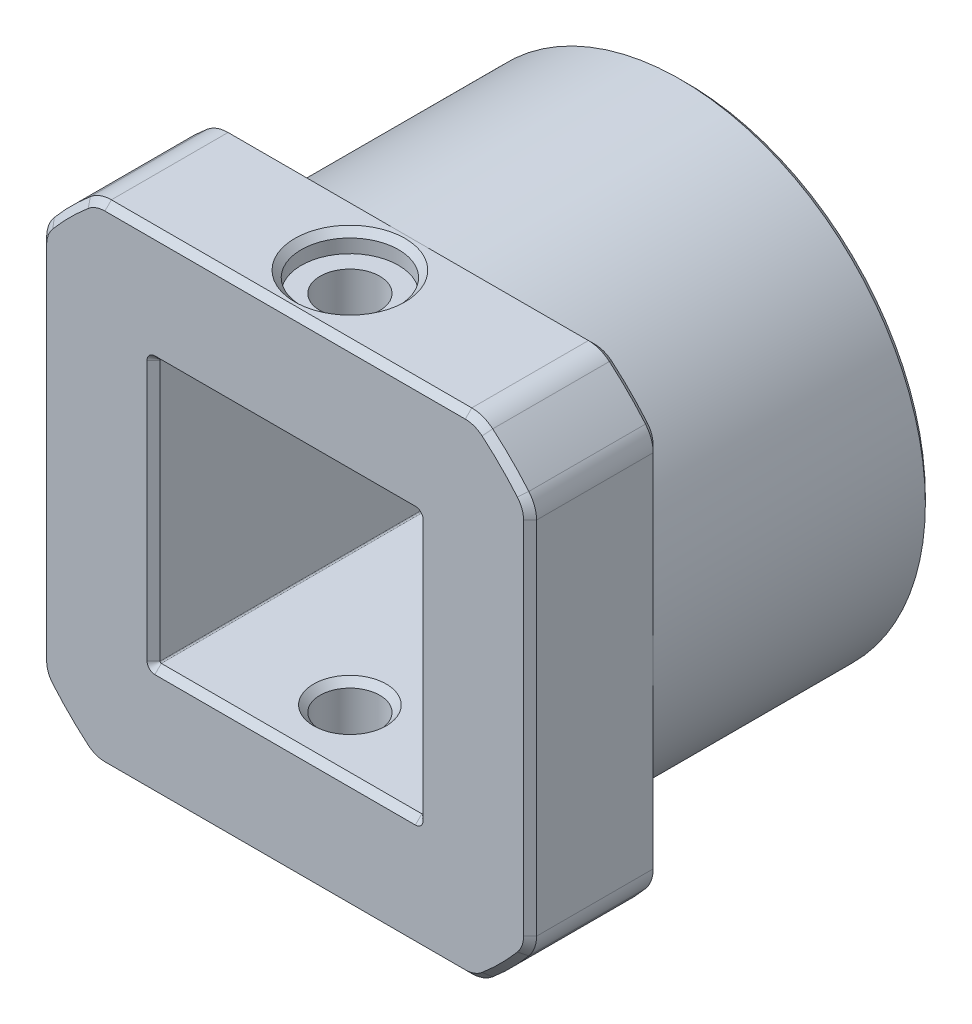
from build123d import *

# Parameters (mm, degrees)
SKIZZE1_R                       = 18.9
SKIZZE1_W                       = 20.3
SKIZZE1_H                       = 20.3
AUFSATZ_LINEAR_AUSTRAGEN1_DEPTH = 21
SKIZZE2_W                       = 20.3
SKIZZE2_H                       = 20.3
AUFSATZ_LINEAR_AUSTRAGEN2_DEPTH = 10
SKIZZE3_R                       = 2.3
SCHNITT_LINEAR_AUSTRAGEN1_DEPTH = 53.412307715
SKETCH1_R                       = 3.75
CUT_EXTRUDE1_DEPTH              = 1.55
CUT_EXTRUDE2_START              = -36.25
SKETCH1_2_R                     = 3.75
CUT_EXTRUDE2_DEPTH              = 1.55
VERRUNDUNG1_R                   = 0.1
VERRUNDUNG2_R                   = 2.5
FASE1_SIZE                      = 0.5
FASE4_SIZE                      = 0.5


with BuildPart() as part:
    # Skizze1 → Aufsatz-Linear austragen1 (new body)
    with BuildSketch(Plane.XY):
        with Locations(Location((0, 0, 0), (0, 0, 180))):
            Circle(SKIZZE1_R)
        Rectangle(SKIZZE1_W, SKIZZE1_H, mode=Mode.SUBTRACT)
    extrude(amount=AUFSATZ_LINEAR_AUSTRAGEN1_DEPTH)

    # Skizze2 → Aufsatz-Linear austragen2 (add)
    with BuildSketch(Plane.XY.offset(21)):
        with BuildLine():
            Line((-14.791551643, 18.9), (14.791551643, 18.9))
            ThreePointArc((14.791551643, 18.9), (16.970562748, 16.970562748), (18.9, 14.791551643))
            Line((18.9, 14.791551643), (18.9, -14.791551643))
            ThreePointArc((18.9, -14.791551643), (16.970562748, -16.970562748), (14.791551643, -18.9))
            Line((14.791551643, -18.9), (-14.791551643, -18.9))
            ThreePointArc((-14.791551643, -18.9), (-16.970562748, -16.970562748), (-18.9, -14.791551643))
            Line((-18.9, -14.791551643), (-18.9, 14.791551643))
            ThreePointArc((-18.9, 14.791551643), (-16.970562748, 16.970562748), (-14.791551643, 18.9))
        make_face()
        Rectangle(SKIZZE2_W, SKIZZE2_H, mode=Mode.SUBTRACT)
    extrude(amount=AUFSATZ_LINEAR_AUSTRAGEN2_DEPTH)

    # Skizze3 → Schnitt-Linear austragen1 (cut, through all)
    with BuildSketch(Plane(origin=(0, 18.9, 0), x_dir=(1, 0, 0), z_dir=(0, 1, 0))):
        with Locations(Location((0, -26, 0), (0, 0, 270))):
            Circle(SKIZZE3_R)
    extrude(amount=-SCHNITT_LINEAR_AUSTRAGEN1_DEPTH, mode=Mode.SUBTRACT)

    # Sketch1 → Cut-Extrude1 (cut)
    with BuildSketch(Plane(origin=(0, 18.9, 0), x_dir=(1, 0, 0), z_dir=(0, 1, 0))):
        with Locations(Location((0, -26, 0), (0, 0, 270))):
            Circle(SKETCH1_R)
    extrude(amount=-CUT_EXTRUDE1_DEPTH, mode=Mode.SUBTRACT)

    # Sketch1<2> → Cut-Extrude2 (cut)
    with BuildSketch(Plane(origin=(0, 18.9, 0), x_dir=(1, 0, 0), z_dir=(0, 1, 0)).offset(CUT_EXTRUDE2_START)):
        with Locations(Location((0, -26, 0), (0, 0, 270))):
            Circle(SKETCH1_2_R)
    extrude(amount=-CUT_EXTRUDE2_DEPTH, mode=Mode.SUBTRACT)

    # Verrundung1
    verrundung1_edges = [part.edges().sort_by_distance(p)[0] for p in [
        (10.15, -10.15, 15.5),
        (10.15, 10.15, 15.5),
        (-10.15, 10.15, 15.5),
        (-10.15, -10.15, 15.5),
    ]]
    fillet(verrundung1_edges, radius=VERRUNDUNG1_R)

    # Verrundung2
    verrundung2_edges = [part.edges().sort_by_distance(p)[0] for p in [
        (-14.791551643, 18.9, 26),
        (-18.9, 14.791551643, 26),
        (-18.9, -14.791551643, 26),
        (-14.791551643, -18.9, 26),
        (14.791551643, -18.9, 26),
        (18.9, -14.791551643, 26),
        (18.9, 14.791551643, 26),
        (14.791551643, 18.9, 26),
    ]]
    fillet(verrundung2_edges, radius=VERRUNDUNG2_R)

    # Fase1
    fase1_edges = [part.edges().sort_by_distance(p)[0] for p in [
        (-16.970562748, -16.970562748, 31),
        (-18.9, 0, 31),
        (-16.970562748, 16.970562748, 31),
        (0, -18.9, 31),
        (16.970562748, -16.970562748, 31),
        (18.9, 0, 31),
        (16.970562748, 16.970562748, 31),
        (0, 18.9, 31),
        (-14.76385305, 18.747066452, 31),
        (-18.747066452, 14.76385305, 31),
        (14.76385305, 18.747066452, 31),
        (18.747066452, 14.76385305, 31),
        (18.747066452, -14.76385305, 31),
        (14.76385305, -18.747066452, 31),
        (-14.76385305, -18.747066452, 31),
        (-18.747066452, -14.76385305, 31),
        (18.9, 0, 0),
        (0, -10.15, 23.7),
        (0, 10.15, 23.7),
        (0, 18.9, 22.25),
        (0, -18.9, 22.25),
        (0, -10.15, 0),
        (0, -10.15, 31),
        (10.15, 0, 0),
        (10.15, 0, 31),
        (-10.15, 0, 0),
        (-10.15, 0, 31),
        (0, 10.15, 0),
        (0, 10.15, 31),
        (10.120710678, -10.120710678, 0),
        (10.120710678, -10.120710678, 31),
        (-10.120710678, -10.120710678, 0),
        (-10.120710678, -10.120710678, 31),
        (-10.120710678, 10.120710678, 0),
        (-10.120710678, 10.120710678, 31),
        (10.120710678, 10.120710678, 0),
        (10.120710678, 10.120710678, 31),
    ]]
    chamfer(fase1_edges, length=FASE1_SIZE)

    # Fase4
    # the kernel refuses this chamfer: 0.5 mm, written as the material it takes off along each edge
    with BuildSketch(Plane(origin=(0, 0, 21), x_dir=(-0.6466454604660656, -0.762790697674421, 0), z_dir=(0.762790697674421, -0.6466454604660656, 0))) as fase4_piece_1:
        Polygon((24, -FASE4_SIZE), (24 - FASE4_SIZE, 0), (24, 0), align=None)
    revolve(axis=Axis((0, 0, 21), (0, 0, -1)), revolution_arc=9.421682318, mode=Mode.SUBTRACT)
    with BuildSketch(Plane(origin=(0, -18.9, 21), x_dir=(0, -0.027495876610589005, 0.9996219169112968), z_dir=(-1, 0, 0))) as fase4_piece_2_section:
        Polygon((FASE4_SIZE * 0.999621916911, FASE4_SIZE * 0.0274958766106), (-FASE4_SIZE * 0.0274958766106, FASE4_SIZE * 0.999621916911), (0, 0), align=None)
    fase4_piece_2 = extrude(amount=13.9028774, mode=Mode.PRIVATE)
    fase4_piece_2 = fase4_piece_2 - Plane(origin=(0, 0, 21.173530337), x_dir=(-1, 0, 0), z_dir=(0, 0, -1)) * Cylinder(18.9, 30, mode=Mode.PRIVATE)
    add(fase4_piece_2, mode=Mode.SUBTRACT)
    with BuildSketch(Plane(origin=(-13.9028774, -16.4, 21), x_dir=(0, -1, 0), z_dir=(1, 0, 0))) as fase4_piece_3:
        Polygon((2.5, -FASE4_SIZE), (2.5 - FASE4_SIZE, 0), (2.5, 0), align=None)
    revolve(axis=Axis((-13.9028774, -16.4, 21), (0, 0, -1)), revolution_arc=40.289158841, mode=Mode.SUBTRACT)
    with BuildSketch(Plane(origin=(-16.4, -13.9028774, 21), x_dir=(-0.7627906976744183, -0.6466454604660687, 0), z_dir=(0.6466454604660687, -0.7627906976744183, 0))) as fase4_piece_4:
        Polygon((2.5, -FASE4_SIZE), (2.5 - FASE4_SIZE, 0), (2.5, 0), align=None)
    revolve(axis=Axis((-16.4, -13.9028774, 21), (0, 0, -1)), revolution_arc=40.289158841, mode=Mode.SUBTRACT)
    with BuildSketch(Plane(origin=(-18.9, 0, 21), x_dir=(-0.027495876610589005, 0, 0.9996219169112968), z_dir=(0, 1, 0))) as fase4_piece_5_section:
        Polygon((FASE4_SIZE * 0.999621916911, FASE4_SIZE * 0.0274958766106), (-FASE4_SIZE * 0.0274958766106, FASE4_SIZE * 0.999621916911), (0, 0), align=None)
    fase4_piece_5 = extrude(amount=13.9028774, mode=Mode.PRIVATE)
    fase4_piece_5 = fase4_piece_5 - Plane(origin=(0, 0, 21.173530342), x_dir=(-1, 0, 0), z_dir=(0, 0, -1)) * Cylinder(18.9, 30, mode=Mode.PRIVATE)
    add(fase4_piece_5, mode=Mode.SUBTRACT)
    with BuildSketch(Plane(origin=(0, 0, 21), x_dir=(0.7627906976744181, -0.646645460466069, 0), z_dir=(0.646645460466069, 0.7627906976744181, 0))) as fase4_piece_6:
        Polygon((24, -FASE4_SIZE), (24 - FASE4_SIZE, 0), (24, 0), align=None)
    revolve(axis=Axis((0, 0, 21), (0, 0, -1)), revolution_arc=9.421682318, mode=Mode.SUBTRACT)
    with BuildSketch(Plane(origin=(18.9, -8.6e-08, 21), x_dir=(0.027495876610589005, 0, 0.9996219169112968), z_dir=(0, -1, 0))) as fase4_piece_7_section:
        Polygon((FASE4_SIZE * 0.999621916911, FASE4_SIZE * 0.0274958766106), (-FASE4_SIZE * 0.0274958766106, FASE4_SIZE * 0.999621916911), (0, 0), align=None)
    fase4_piece_7 = extrude(amount=13.902877314, mode=Mode.PRIVATE)
    fase4_piece_7 = fase4_piece_7 - Plane(origin=(0, 0, 21.173530337), x_dir=(-1, 0, 0), z_dir=(0, 0, -1)) * Cylinder(18.9, 30, mode=Mode.PRIVATE)
    add(fase4_piece_7, mode=Mode.SUBTRACT)
    with BuildSketch(Plane(origin=(16.4, -13.9028774, 21), x_dir=(1, 0, 0), z_dir=(0, 1, 0))) as fase4_piece_8:
        Polygon((2.5, -FASE4_SIZE), (2.5 - FASE4_SIZE, 0), (2.5, 0), align=None)
    revolve(axis=Axis((16.4, -13.9028774, 21), (0, 0, -1)), revolution_arc=40.289158841, mode=Mode.SUBTRACT)
    with BuildSketch(Plane(origin=(13.9028774, -16.4, 21), x_dir=(0.64664546046607, -0.7627906976744174, 0), z_dir=(0.7627906976744174, 0.64664546046607, 0))) as fase4_piece_9:
        Polygon((2.5, -FASE4_SIZE), (2.5 - FASE4_SIZE, 0), (2.5, 0), align=None)
    revolve(axis=Axis((13.9028774, -16.4, 21), (0, 0, -1)), revolution_arc=40.289158841, mode=Mode.SUBTRACT)
    with BuildSketch(Plane(origin=(0, 0, 21), x_dir=(0.6466454604660691, 0.762790697674418, 0), z_dir=(-0.762790697674418, 0.6466454604660691, 0))) as fase4_piece_10:
        Polygon((24, -FASE4_SIZE), (24 - FASE4_SIZE, 0), (24, 0), align=None)
    revolve(axis=Axis((0, 0, 21), (0, 0, -1)), revolution_arc=9.421682318, mode=Mode.SUBTRACT)
    with BuildSketch(Plane(origin=(2.2e-08, 18.9, 21), x_dir=(0, 0.027495876610589005, 0.9996219169112968), z_dir=(1, 0, 0))) as fase4_piece_11_section:
        Polygon((FASE4_SIZE * 0.999621916911, FASE4_SIZE * 0.0274958766106), (-FASE4_SIZE * 0.0274958766106, FASE4_SIZE * 0.999621916911), (0, 0), align=None)
    fase4_piece_11 = extrude(amount=13.902877378, mode=Mode.PRIVATE)
    fase4_piece_11 = fase4_piece_11 - Plane(origin=(0, 0, 21.173530337), x_dir=(-1, 0, 0), z_dir=(0, 0, -1)) * Cylinder(18.9, 30, mode=Mode.PRIVATE)
    add(fase4_piece_11, mode=Mode.SUBTRACT)
    with BuildSketch(Plane(origin=(13.9028774, 16.4, 21), x_dir=(0, 1, 0), z_dir=(-1, 0, 0))) as fase4_piece_12:
        Polygon((2.5, -FASE4_SIZE), (2.5 - FASE4_SIZE, 0), (2.5, 0), align=None)
    revolve(axis=Axis((13.9028774, 16.4, 21), (0, 0, -1)), revolution_arc=40.289158841, mode=Mode.SUBTRACT)
    with BuildSketch(Plane(origin=(16.4, 13.9028774, 21), x_dir=(0.7627906976744174, 0.64664546046607, 0), z_dir=(-0.64664546046607, 0.7627906976744174, 0))) as fase4_piece_13:
        Polygon((2.5, -FASE4_SIZE), (2.5 - FASE4_SIZE, 0), (2.5, 0), align=None)
    revolve(axis=Axis((16.4, 13.9028774, 21), (0, 0, -1)), revolution_arc=40.289158841, mode=Mode.SUBTRACT)
    with BuildSketch(Plane(origin=(0, 0, 21), x_dir=(-0.7627906976744193, 0.6466454604660676, 0), z_dir=(-0.6466454604660676, -0.7627906976744193, 0))) as fase4_piece_14:
        Polygon((24, -FASE4_SIZE), (24 - FASE4_SIZE, 0), (24, 0), align=None)
    revolve(axis=Axis((0, 0, 21), (0, 0, -1)), revolution_arc=9.421682318, mode=Mode.SUBTRACT)
    with BuildSketch(Plane(origin=(-13.9028774, 16.4, 21), x_dir=(0, 1, 0), z_dir=(1, 0, 0))) as fase4_piece_15:
        Polygon((2.5, FASE4_SIZE), (2.5 - FASE4_SIZE, 0), (2.5, 0), align=None)
    revolve(axis=Axis((-13.9028774, 16.4, 21), (0, 0, 1)), revolution_arc=40.289158841, mode=Mode.SUBTRACT)
    with BuildSketch(Plane(origin=(-16.4, 13.9028774, 21), x_dir=(-1, 0, 0), z_dir=(0, -1, 0))) as fase4_piece_16:
        Polygon((2.5, -FASE4_SIZE), (2.5 - FASE4_SIZE, 0), (2.5, 0), align=None)
    revolve(axis=Axis((-16.4, 13.9028774, 21), (0, 0, -1)), revolution_arc=40.289158841, mode=Mode.SUBTRACT)
    with BuildSketch(Plane(origin=(-18.9, -13.9028774, 21), x_dir=(-0.027495876610589005, 0, 0.9996219169112968), z_dir=(0, 1, 0))) as fase4_piece_17_section:
        Polygon((FASE4_SIZE * 0.999621916911, FASE4_SIZE * 0.0274958766106), (-FASE4_SIZE * 0.0274958766106, FASE4_SIZE * 0.999621916911), (0, 0), align=None)
    fase4_piece_17 = extrude(amount=13.9028774, mode=Mode.PRIVATE)
    fase4_piece_17 = fase4_piece_17 - Plane(origin=(0, 0, 21.173530332), x_dir=(-1, 0, 0), z_dir=(0, 0, -1)) * Cylinder(18.9, 30, mode=Mode.PRIVATE)
    add(fase4_piece_17, mode=Mode.SUBTRACT)
    with BuildSketch(Plane(origin=(13.9028774, -18.9, 21), x_dir=(0, -0.027495876610589005, 0.9996219169112968), z_dir=(-1, 0, 0))) as fase4_piece_18_section:
        Polygon((FASE4_SIZE * 0.999621916911, FASE4_SIZE * 0.0274958766106), (-FASE4_SIZE * 0.0274958766106, FASE4_SIZE * 0.999621916911), (0, 0), align=None)
    fase4_piece_18 = extrude(amount=13.9028774, mode=Mode.PRIVATE)
    fase4_piece_18 = fase4_piece_18 - Plane(origin=(0, 0, 21.173530332), x_dir=(-1, 0, 0), z_dir=(0, 0, -1)) * Cylinder(18.9, 30, mode=Mode.PRIVATE)
    add(fase4_piece_18, mode=Mode.SUBTRACT)
    with BuildSketch(Plane(origin=(18.9, 13.9028774, 21), x_dir=(0.027495876610589005, 0, 0.9996219169112968), z_dir=(0, -1, 0))) as fase4_piece_19_section:
        Polygon((FASE4_SIZE * 0.999621916911, FASE4_SIZE * 0.0274958766106), (-FASE4_SIZE * 0.0274958766106, FASE4_SIZE * 0.999621916911), (0, 0), align=None)
    fase4_piece_19 = extrude(amount=13.902877486, mode=Mode.PRIVATE)
    fase4_piece_19 = fase4_piece_19 - Plane(origin=(0, 0, 21.173530332), x_dir=(-1, 0, 0), z_dir=(0, 0, -1)) * Cylinder(18.9, 30, mode=Mode.PRIVATE)
    add(fase4_piece_19, mode=Mode.SUBTRACT)
    with BuildSketch(Plane(origin=(-13.9028774, 18.9, 21), x_dir=(0, 0.027495876610589005, 0.9996219169112968), z_dir=(1, 0, 0))) as fase4_piece_20_section:
        Polygon((FASE4_SIZE * 0.999621916911, FASE4_SIZE * 0.0274958766106), (-FASE4_SIZE * 0.0274958766106, FASE4_SIZE * 0.999621916911), (0, 0), align=None)
    fase4_piece_20 = extrude(amount=13.902877422, mode=Mode.PRIVATE)
    fase4_piece_20 = fase4_piece_20 - Plane(origin=(0, 0, 21.173530342), x_dir=(-1, 0, 0), z_dir=(0, 0, -1)) * Cylinder(18.9, 30, mode=Mode.PRIVATE)
    add(fase4_piece_20, mode=Mode.SUBTRACT)


solid = part.part
